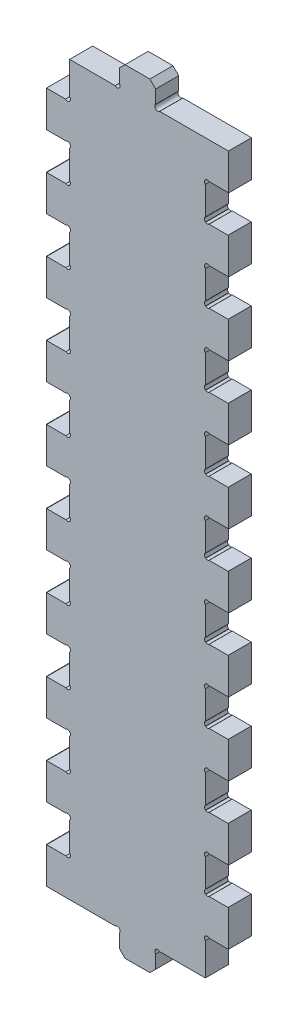
from build123d import *

# Parameters (mm, degrees)
BOSS_EXTRUDE1_DEPTH = 6.35
CHAMFER1_SIZE       = 1.5875
SKETCH1_W           = 6.288243006
SKETCH1_H           = 10.1524
SKETCH1_W_2         = 6.300894721
CUT_EXTRUDE1_DEPTH  = 213.416207009
LPATTERN1_COUNT     = 9
LPATTERN1_PITCH     = 20
SKETCH2_W           = 2.992753623
SKETCH2_H           = 0.405797101
CUT_EXTRUDE2_DEPTH  = 2.54


# Read off the part's stored shape, not the designer's step: Boss-Extrude1
with BuildPart() as part:
    # Boss-Extrude1 outline → Boss-Extrude1 (new body)
    with BuildSketch(Plane.XY):
        with BuildLine():
            Line((43.65, 81.122532015), (43.65, 88.877467985))
            ThreePointArc((43.65, 88.877467985), (43.65, 90), (44.772532015, 90))
            Line((44.772532015, 90), (50, 90))
            Line((50, 90), (50, 100))
            Line((50, 100), (44.772532015, 100))
            ThreePointArc((44.772532015, 100), (43.65, 100), (43.65, 101.122532015))
            Line((43.65, 101.122532015), (43.65, 108.877467985))
            ThreePointArc((43.65, 108.877467985), (43.65, 110), (44.772532015, 110))
            Line((44.772532015, 110), (50, 110))
            Line((50, 110), (50, 120))
            Line((50, 120), (44.772532015, 120))
            ThreePointArc((44.772532015, 120), (43.65, 120), (43.65, 121.122532015))
            Line((43.65, 121.122532015), (43.65, 128.877467985))
            ThreePointArc((43.65, 128.877467985), (43.65, 130), (44.772532015, 130))
            Line((44.772532015, 130), (50, 130))
            Line((50, 130), (50, 140))
            Line((50, 140), (44.772532015, 140))
            ThreePointArc((44.772532015, 140), (43.65, 140), (43.65, 141.122532015))
            Line((43.65, 141.122532015), (43.65, 148.877467985))
            ThreePointArc((43.65, 148.877467985), (43.65, 150), (44.772532015, 150))
            Line((44.772532015, 150), (50, 150))
            Line((50, 150), (50, 160))
            Line((50, 160), (44.772532015, 160))
            ThreePointArc((44.772532015, 160), (43.65, 160), (43.65, 161.122532015))
            Line((43.65, 161.122532015), (43.65, 168.877467985))
            ThreePointArc((43.65, 168.877467985), (43.65, 170), (44.772532015, 170))
            Line((44.772532015, 170), (50, 170))
            Line((50, 170), (50, 180))
            Line((50, 180), (44.772532015, 180))
            ThreePointArc((44.772532015, 180), (43.65, 180), (43.65, 181.122532015))
            Line((43.65, 181.122532015), (43.65, 188.877467985))
            ThreePointArc((43.65, 188.877467985), (43.65, 190), (44.772532015, 190))
            Line((44.772532015, 190), (50, 190))
            Line((50, 190), (50, 200))
            Line((50, 200), (31.122532015, 200))
            ThreePointArc((31.122532015, 200), (30, 200), (30, 201.122532015))
            Line((30, 201.122532015), (30, 206.35))
            Line((30, 206.35), (20, 206.35))
            Line((20, 206.35), (20, 201.122532015))
            ThreePointArc((20, 201.122532015), (20, 200), (18.877467985, 200))
            Line((18.877467985, 200), (6.35, 200))
            Line((6.35, 200), (6.35, 191.122532015))
            ThreePointArc((6.35, 191.122532015), (6.35, 190), (5.227467985, 190))
            Line((5.227467985, 190), (0, 190))
            Line((0, 190), (0, 180))
            Line((0, 180), (5.227467985, 180))
            ThreePointArc((5.227467985, 180), (6.35, 180), (6.35, 178.877467985))
            Line((6.35, 178.877467985), (6.35, 171.122532015))
            ThreePointArc((6.35, 171.122532015), (6.35, 170), (5.227467985, 170))
            Line((5.227467985, 170), (0, 170))
            Line((0, 170), (0, 160))
            Line((0, 160), (5.227467985, 160))
            ThreePointArc((5.227467985, 160), (6.35, 160), (6.35, 158.877467985))
            Line((6.35, 158.877467985), (6.35, 151.122532015))
            ThreePointArc((6.35, 151.122532015), (6.35, 150), (5.227467985, 150))
            Line((5.227467985, 150), (0, 150))
            Line((0, 150), (0, 140))
            Line((0, 140), (5.227467985, 140))
            ThreePointArc((5.227467985, 140), (6.35, 140), (6.35, 138.877467985))
            Line((6.35, 138.877467985), (6.35, 131.122532015))
            ThreePointArc((6.35, 131.122532015), (6.35, 130), (5.227467985, 130))
            Line((5.227467985, 130), (0, 130))
            Line((0, 130), (0, 120))
            Line((0, 120), (5.227467985, 120))
            ThreePointArc((5.227467985, 120), (6.35, 120), (6.35, 118.877467985))
            Line((6.35, 118.877467985), (6.35, 111.122532015))
            ThreePointArc((6.35, 111.122532015), (6.35, 110), (5.227467985, 110))
            Line((5.227467985, 110), (0, 110))
            Line((0, 110), (0, 100))
            Line((0, 100), (5.227467985, 100))
            ThreePointArc((5.227467985, 100), (6.35, 100), (6.35, 98.877467985))
            Line((6.35, 98.877467985), (6.35, 91.122532015))
            ThreePointArc((6.35, 91.122532015), (6.35, 90), (5.227467985, 90))
            Line((5.227467985, 90), (0, 90))
            Line((0, 90), (0, 80))
            Line((0, 80), (5.227467985, 80))
            ThreePointArc((5.227467985, 80), (6.35, 80), (6.35, 78.877467985))
            Line((6.35, 78.877467985), (6.35, 71.122532015))
            ThreePointArc((6.35, 71.122532015), (6.35, 70), (5.227467985, 70))
            Line((5.227467985, 70), (0, 70))
            Line((0, 70), (0, 60))
            Line((0, 60), (5.227467985, 60))
            ThreePointArc((5.227467985, 60), (6.35, 60), (6.35, 58.877467985))
            Line((6.35, 58.877467985), (6.35, 51.122532015))
            ThreePointArc((6.35, 51.122532015), (6.35, 50), (5.227467985, 50))
            Line((5.227467985, 50), (0, 50))
            Line((0, 50), (0, 40))
            Line((0, 40), (5.227467985, 40))
            ThreePointArc((5.227467985, 40), (6.35, 40), (6.35, 38.877467985))
            Line((6.35, 38.877467985), (6.35, 31.122532015))
            ThreePointArc((6.35, 31.122532015), (6.35, 30), (5.227467985, 30))
            Line((5.227467985, 30), (0, 30))
            Line((0, 30), (0, 20))
            Line((0, 20), (5.227467985, 20))
            ThreePointArc((5.227467985, 20), (6.35, 20), (6.35, 18.877467985))
            Line((6.35, 18.877467985), (6.35, 11.122532015))
            ThreePointArc((6.35, 11.122532015), (6.35, 10), (5.227467985, 10))
            Line((5.227467985, 10), (0, 10))
            Line((0, 10), (0, 0))
            Line((0, 0), (18.877467985, 0))
            ThreePointArc((18.877467985, 0), (20, 0), (20, -1.122532015))
            Line((20, -1.122532015), (20, -6.35))
            Line((20, -6.35), (30, -6.35))
            Line((30, -6.35), (30, -1.122532015))
            ThreePointArc((30, -1.122532015), (30, 0), (31.122532015, 0))
            Line((31.122532015, 0), (43.65, 0))
            Line((43.65, 0), (43.65, 8.877467985))
            ThreePointArc((43.65, 8.877467985), (43.65, 10), (44.772532015, 10))
            Line((44.772532015, 10), (50, 10))
            Line((50, 10), (50, 20))
            Line((50, 20), (44.772532015, 20))
            ThreePointArc((44.772532015, 20), (43.65, 20), (43.65, 21.122532015))
            Line((43.65, 21.122532015), (43.65, 28.877467985))
            ThreePointArc((43.65, 28.877467985), (43.65, 30), (44.772532015, 30))
            Line((44.772532015, 30), (50, 30))
            Line((50, 30), (50, 40))
            Line((50, 40), (44.772532015, 40))
            ThreePointArc((44.772532015, 40), (43.65, 40), (43.65, 41.122532015))
            Line((43.65, 41.122532015), (43.65, 48.877467985))
            ThreePointArc((43.65, 48.877467985), (43.65, 50), (44.772532015, 50))
            Line((44.772532015, 50), (50, 50))
            Line((50, 50), (50, 60))
            Line((50, 60), (44.772532015, 60))
            ThreePointArc((44.772532015, 60), (43.65, 60), (43.65, 61.122532015))
            Line((43.65, 61.122532015), (43.65, 68.877467985))
            ThreePointArc((43.65, 68.877467985), (43.65, 70), (44.772532015, 70))
            Line((44.772532015, 70), (50, 70))
            Line((50, 70), (50, 80))
            Line((50, 80), (44.772532015, 80))
            ThreePointArc((44.772532015, 80), (43.65, 80), (43.65, 81.122532015))
        make_face()
    extrude(amount=BOSS_EXTRUDE1_DEPTH)

    # Chamfer1
    chamfer1_edges = [part.edges().sort_by_distance(p)[0] for p in [
        (30, -6.35, 3.175),
        (20, -6.35, 3.175),
        (20, 206.35, 3.175),
        (30, 206.35, 3.175),
    ]]
    chamfer(chamfer1_edges, length=CHAMFER1_SIZE)

    # Sketch1 → Cut-Extrude1 (cut, through all)
    with BuildSketch(Plane.XY.offset(6.35)):
        with Locations((3.175005578, 175)):
            Rectangle(SKETCH1_W, SKETCH1_H)
        with Locations((46.824995526, 185)):
            Rectangle(SKETCH1_W_2, SKETCH1_H)
    cut_extrude1 = extrude(amount=-CUT_EXTRUDE1_DEPTH, mode=Mode.SUBTRACT)

    # LPattern1: Cut-Extrude1 ×9
    with Locations(*[(0, -i * LPATTERN1_PITCH, 0) for i in range(1, LPATTERN1_COUNT)]):
        add(cut_extrude1, mode=Mode.SUBTRACT)

    # Sketch2 → Cut-Extrude2 (cut)
    # profile 1 of 8: a face of its own
    with BuildSketch(Plane(origin=(0, 0, 0), x_dir=(-1, 0, 0), z_dir=(0, 0, -1))):
        with BuildLine():
            add(Edge.make_bspline(
                [(-11.980434783, 197.750941647), (-11.910808489, 197.774482029), (-11.771664099, 197.821526211), (-11.555640029, 197.867946068), (-11.335332216, 197.897801238), (-11.186640087, 197.9013359), (-11.111775362, 197.90311556)],
                knots=[0, 0, 0, 0, 0.994488486, 1.987431555, 2.986695647, 4, 4, 4, 4], degree=3))
            add(Edge.make_bspline(
                [(-11.111775362, 197.90311556), (-11.05254015, 197.901735769), (-10.937130794, 197.899047491), (-10.769325868, 197.878500612), (-10.612296865, 197.843425686), (-10.465271323, 197.795823751), (-10.330023421, 197.731389451), (-10.204221941, 197.655235673), (-10.089369065, 197.564290581), (-9.985915155, 197.458859286), (-9.893783764, 197.34017602), (-9.812916705, 197.20835234), (-9.745945374, 197.062602349), (-9.691314855, 196.903725539), (-9.648801528, 196.731815794), (-9.618170665, 196.546875928), (-9.599922356, 196.348454994), (-9.597584367, 196.211805499), (-9.596376812, 196.141226973)],
                knots=[0, 0, 0, 0, 1.072611527, 2.089794271, 3.055581239, 3.983062688, 4.882004399, 5.762484854, 6.641234626, 7.527661933, 8.431137849, 9.356753919, 10.322173417, 11.329916297, 12.395192928, 13.52550975, 14.721942779, 16, 16, 16, 16], degree=3))
            add(Edge.make_bspline(
                [(-9.596376812, 196.141226973), (-9.597826972, 196.072491969), (-9.600660995, 195.938164378), (-9.620448173, 195.741481707), (-9.654333732, 195.55486754), (-9.701885812, 195.378938505), (-9.761015566, 195.214319069), (-9.832414573, 195.06209312), (-9.915722389, 194.922884328), (-10.010344121, 194.796720603), (-10.116629395, 194.684246688), (-10.233247243, 194.584630449), (-10.361197037, 194.499499449), (-10.49863623, 194.427797069), (-10.645940087, 194.37132884), (-10.802277721, 194.331182069), (-10.967222779, 194.305740648), (-11.080241691, 194.303043167), (-11.137930254, 194.301666285)],
                knots=[0, 0, 0, 0, 1.219605637, 2.383453508, 3.503420428, 4.581493474, 5.613637893, 6.603468646, 7.560207789, 8.487492747, 9.396163682, 10.300762231, 11.203110698, 12.117315488, 13.046269834, 13.995710842, 14.976945019, 16, 16, 16, 16], degree=3))
            add(Edge.make_bspline(
                [(-11.137930254, 194.301666285), (-11.17730863, 194.302082953), (-11.254810493, 194.30290301), (-11.368724701, 194.310544894), (-11.478618874, 194.320962333), (-11.618020807, 194.343473627), (-11.787188939, 194.382017712), (-11.916157014, 194.429950478), (-11.980434783, 194.453840198)],
                knots=[0, 0, 0, 0, 0.822626155, 1.619037258, 2.384688107, 3.12792479, 4.568555946, 6, 6, 6, 6], degree=3))
            Line((-11.980434783, 194.453840198), (-11.980434783, 194.910361937))
            add(Edge.make_bspline(
                [(-11.980434783, 194.910361937), (-11.94918244, 194.894384261), (-11.887250767, 194.862721859), (-11.791296825, 194.822227498), (-11.693860043, 194.787552165), (-11.594405533, 194.757408159), (-11.491160414, 194.735714483), (-11.384109045, 194.718617622), (-11.272305975, 194.709298747), (-11.196331968, 194.708081586), (-11.157744565, 194.707463386)],
                knots=[0, 0, 0, 0, 0.983513914, 1.948995141, 2.916291929, 3.881574371, 4.859020865, 5.870675395, 6.918510301, 8, 8, 8, 8], degree=3))
            add(Edge.make_bspline(
                [(-11.157744565, 194.707463386), (-11.118298946, 194.708338051), (-11.040812889, 194.710056222), (-10.927951046, 194.729225669), (-10.820608309, 194.758204113), (-10.719660859, 194.799841942), (-10.624784183, 194.85189007), (-10.538252255, 194.916223742), (-10.45790836, 194.989524697), (-10.385933705, 195.074323927), (-10.320400401, 195.168726608), (-10.26472386, 195.274354392), (-10.215098966, 195.388559737), (-10.175089938, 195.513194807), (-10.142496376, 195.646874086), (-10.119876023, 195.790009932), (-10.106357968, 195.942029028), (-10.104552061, 196.046353634), (-10.103623188, 196.100013205)],
                knots=[0, 0, 0, 0, 0.961379654, 1.888511819, 2.784473984, 3.668957356, 4.545988938, 5.417413694, 6.293189242, 7.19359124, 8.125014672, 9.091028027, 10.101492058, 11.15929442, 12.280112618, 13.455191333, 14.691072557, 16, 16, 16, 16], degree=3))
            add(Edge.make_bspline(
                [(-10.103623188, 196.100013205), (-10.104279682, 196.156045066), (-10.105551143, 196.264564559), (-10.118282272, 196.422100739), (-10.139770132, 196.568946395), (-10.168075198, 196.705811394), (-10.207570319, 196.831074698), (-10.252845969, 196.946674705), (-10.308874295, 197.050705115), (-10.372033391, 197.144976812), (-10.444154984, 197.227969509), (-10.523426101, 197.301231742), (-10.612549541, 197.36110343), (-10.70801986, 197.412059214), (-10.812318312, 197.449646578), (-10.923789687, 197.477497305), (-11.04336801, 197.494349547), (-11.125722455, 197.496310592), (-11.168048007, 197.497318458)],
                knots=[0, 0, 0, 0, 1.344986745, 2.604897925, 3.790693513, 4.906561358, 5.955763371, 6.940386222, 7.882436293, 8.786639374, 9.6589598, 10.516513575, 11.369740757, 12.229356076, 13.108292045, 14.02357188, 14.984227133, 16, 16, 16, 16], degree=3))
            add(Edge.make_bspline(
                [(-11.168048007, 197.497318458), (-11.204535527, 197.496804387), (-11.276867419, 197.495785306), (-11.384272153, 197.484719098), (-11.489556057, 197.468787813), (-11.625664857, 197.436136281), (-11.792332677, 197.384731417), (-11.917679042, 197.324550169), (-11.980434783, 197.294419908)],
                knots=[0, 0, 0, 0, 0.776740194, 1.539789185, 2.297342553, 3.042488778, 4.519296457, 6, 6, 6, 6], degree=3))
            Line((-11.980434783, 197.294419908), (-11.980434783, 197.750941647))
        make_face()
    # profile 2 of 8: a face of its own
    with BuildSketch(Plane(origin=(0, 0, 0), x_dir=(-1, 0, 0), z_dir=(0, 0, -1))):
        with BuildLine():
            add(Edge.make_bspline(
                [(-15.176086957, 196.079406321), (-15.174771545, 196.155545347), (-15.172231466, 196.302570874), (-15.151308744, 196.515001048), (-15.118130195, 196.711634176), (-15.069724598, 196.892163431), (-15.008957382, 197.056546508), (-14.940397786, 197.206966734), (-14.86119578, 197.341840598), (-14.77277724, 197.46226813), (-14.674486067, 197.567059165), (-14.569409518, 197.659291985), (-14.45447056, 197.734843734), (-14.333083054, 197.797066416), (-14.205354243, 197.844037281), (-14.074059365, 197.878613559), (-13.939232158, 197.898644395), (-13.848327544, 197.901618272), (-13.802558877, 197.90311556)],
                knots=[0, 0, 0, 0, 1.423032467, 2.74789565, 3.986095212, 5.146946287, 6.235977115, 7.259045831, 8.233104616, 9.154680255, 10.045738054, 10.914074377, 11.761945621, 12.610090105, 13.458637099, 14.300735339, 15.144454002, 16, 16, 16, 16], degree=3))
            add(Edge.make_bspline(
                [(-13.802558877, 197.90311556), (-13.748596863, 197.901519891), (-13.643894221, 197.898423811), (-13.491777719, 197.876600142), (-13.350997388, 197.837353492), (-13.220196311, 197.784325199), (-13.101101854, 197.715530574), (-12.991808098, 197.634048671), (-12.893892487, 197.538257879), (-12.807251809, 197.428663355), (-12.730945273, 197.306184641), (-12.664179781, 197.171565813), (-12.610091483, 197.023445331), (-12.564800826, 196.864008607), (-12.530756348, 196.692952246), (-12.505191733, 196.511203539), (-12.490128224, 196.319020109), (-12.488509105, 196.187222831), (-12.487681159, 196.119827516)],
                knots=[0, 0, 0, 0, 1.030205197, 1.998909912, 2.925271583, 3.814184362, 4.686309791, 5.543784517, 6.410540358, 7.293595139, 8.204656581, 9.161097379, 10.157022635, 11.210838011, 12.322710013, 13.48400651, 14.713431915, 16, 16, 16, 16], degree=3))
            add(Edge.make_bspline(
                [(-12.487681159, 196.119827516), (-12.489103582, 196.04449099), (-12.491853818, 195.898828739), (-12.511416567, 195.687872829), (-12.545069085, 195.492456089), (-12.592624482, 195.31245948), (-12.652212847, 195.148036018), (-12.721224493, 194.99810088), (-12.799394098, 194.862339633), (-12.888522038, 194.742126758), (-12.986580423, 194.636821352), (-13.092191658, 194.545841852), (-13.206175828, 194.469611896), (-13.327169003, 194.408148274), (-13.453828345, 194.360553231), (-13.584416592, 194.326109451), (-13.718987351, 194.306142846), (-13.809892364, 194.30316538), (-13.855661232, 194.301666285)],
                knots=[0, 0, 0, 0, 1.413051082, 2.732116977, 3.969679154, 5.128442986, 6.219508914, 7.246084667, 8.220979251, 9.152645917, 10.046758226, 10.914837981, 11.761492386, 12.612544275, 13.454719919, 14.29491033, 15.141521225, 16, 16, 16, 16], degree=3))
            add(Edge.make_bspline(
                [(-13.855661232, 194.301666285), (-13.90964448, 194.303151965), (-14.014688824, 194.306042904), (-14.166738924, 194.329462218), (-14.308341052, 194.366946721), (-14.438473901, 194.421302537), (-14.557584663, 194.490388126), (-14.667019041, 194.572013953), (-14.764785966, 194.668542572), (-14.853677415, 194.77663151), (-14.930292573, 194.8990667), (-14.997060368, 195.033347521), (-15.052193753, 195.180470021), (-15.098037373, 195.339171784), (-15.133572751, 195.509270472), (-15.157106098, 195.690278859), (-15.174055158, 195.88120747), (-15.175398635, 196.012261581), (-15.176086957, 196.079406321)],
                knots=[0, 0, 0, 0, 1.031565915, 2.007292433, 2.933542939, 3.825562189, 4.694461596, 5.560140367, 6.428041038, 7.314667795, 8.229626955, 9.182805641, 10.177100349, 11.228845024, 12.338260739, 13.495395501, 14.716781815, 16, 16, 16, 16], degree=3))
        make_face()
        with BuildLine():
            add(Edge.make_bspline(
                [(-14.66884058, 196.113486937), (-14.668104325, 196.062754666), (-14.666661604, 195.963342785), (-14.659112786, 195.817323142), (-14.644731767, 195.677971105), (-14.625210171, 195.545636766), (-14.599851804, 195.420845169), (-14.56528676, 195.305413914), (-14.52602863, 195.19787145), (-14.478831316, 195.099685024), (-14.423864296, 195.011407792), (-14.363049349, 194.93238167), (-14.292856708, 194.865666962), (-14.21702944, 194.807391129), (-14.131375198, 194.762764903), (-14.038085919, 194.730009945), (-13.93622166, 194.710867881), (-13.865781731, 194.708620665), (-13.829506341, 194.707463386)],
                knots=[0, 0, 0, 0, 1.323224684, 2.592910887, 3.811929415, 4.975431619, 6.080847083, 7.12955438, 8.115035924, 9.06419821, 9.964747517, 10.823495656, 11.656766287, 12.483602299, 13.309634052, 14.163864548, 15.054420842, 16, 16, 16, 16], degree=3))
            add(Edge.make_bspline(
                [(-13.829506341, 194.707463386), (-13.794265277, 194.708823771), (-13.725529993, 194.71147711), (-13.626565143, 194.732373671), (-13.53532031, 194.766790374), (-13.452296433, 194.815090147), (-13.376747759, 194.87511133), (-13.308366436, 194.945404655), (-13.247032964, 195.025257061), (-13.193108891, 195.114827257), (-13.145970427, 195.213223055), (-13.104573434, 195.319644786), (-13.070755463, 195.434291436), (-13.043596163, 195.556211276), (-13.021063583, 195.683877317), (-13.006806767, 195.816293169), (-12.996583139, 195.952435228), (-12.995485311, 196.044512933), (-12.994927536, 196.091294908)],
                knots=[0, 0, 0, 0, 0.938375319, 1.830236864, 2.681329516, 3.526521267, 4.378544967, 5.244700333, 6.133138318, 7.055481868, 8.025176963, 9.036984759, 10.094880601, 11.206586202, 12.363869853, 13.547026066, 14.753716057, 16, 16, 16, 16], degree=3))
            add(Edge.make_bspline(
                [(-12.994927536, 196.091294908), (-12.995554209, 196.142561735), (-12.996776188, 196.242529233), (-13.005769451, 196.389008359), (-13.0195816, 196.528457315), (-13.040026297, 196.660800429), (-13.066826466, 196.78523405), (-13.099518015, 196.901313999), (-13.140383308, 197.00791249), (-13.18637062, 197.105941137), (-13.240975353, 197.19342316), (-13.300690973, 197.272606444), (-13.370597388, 197.338964761), (-13.44636823, 197.396383534), (-13.53032357, 197.442040613), (-13.62274568, 197.474851461), (-13.723576272, 197.493907207), (-13.79349408, 197.496158761), (-13.829506341, 197.497318458)],
                knots=[0, 0, 0, 0, 1.340763136, 2.614414457, 3.836861922, 5.004679881, 6.114646625, 7.164372586, 8.155062869, 9.097671087, 9.991240131, 10.848152089, 11.683766599, 12.503256002, 13.328782241, 14.17238617, 15.058658899, 16, 16, 16, 16], degree=3))
            add(Edge.make_bspline(
                [(-13.829506341, 197.497318458), (-13.864726556, 197.495873249), (-13.933109002, 197.493067276), (-14.032397832, 197.473411738), (-14.123491589, 197.437761024), (-14.207460738, 197.389744045), (-14.283866648, 197.329971708), (-14.352132282, 197.25887327), (-14.415229102, 197.179859368), (-14.469930885, 197.090134376), (-14.516822102, 196.99174734), (-14.558446295, 196.885610107), (-14.592939279, 196.771301666), (-14.621334631, 196.64980419), (-14.642437177, 196.522133205), (-14.657087598, 196.389827514), (-14.667156303, 196.253133776), (-14.668273177, 196.160531474), (-14.66884058, 196.113486937)],
                knots=[0, 0, 0, 0, 0.936751022, 1.818765843, 2.677461868, 3.527284708, 4.383360161, 5.248016241, 6.143560069, 7.067973536, 8.03599012, 9.039498541, 10.097595286, 11.208955057, 12.356128457, 13.537236666, 14.748847947, 16, 16, 16, 16], degree=3))
        make_face(mode=Mode.SUBTRACT)
    # profile 3 of 8: a face of its own
    with BuildSketch(Plane(origin=(0, 0, 0), x_dir=(-1, 0, 0), z_dir=(0, 0, -1))):
        Polygon((-17.965942029, 197.852390922), (-15.936956522, 197.852390922), (-15.936956522, 194.352390922), (-16.444202899, 194.352390922), (-16.444202899, 197.446593821), (-17.965942029, 197.446593821), align=None)
    # profile 4 of 8: a face of its own
    with BuildSketch(Plane(origin=(0, 0, 0), x_dir=(-1, 0, 0), z_dir=(0, 0, -1))):
        with Locations((-19.817391304, 198.7654344)):
            Rectangle(SKETCH2_W, SKETCH2_H)
    # profile 5 of 8: a face of its own
    with BuildSketch(Plane(origin=(0, 0, 0), x_dir=(-1, 0, 0), z_dir=(0, 0, -1))):
        Polygon((-24.28115942, 197.852390922), (-23.762024457, 197.852390922), (-23.527423007, 197.091521357), (-22.073845109, 197.091521357), (-21.833695652, 197.852390922), (-21.339130435, 197.852390922), (-22.502626812, 194.352390922), (-23.154913949, 194.352390922), align=None)
        Polygon((-23.40298913, 196.685724256), (-22.810144928, 194.760565741), (-22.202241848, 196.685724256), align=None, mode=Mode.SUBTRACT)
    # profile 6 of 8: a face of its own
    with BuildSketch(Plane(origin=(0, 0, 0), x_dir=(-1, 0, 0), z_dir=(0, 0, -1))):
        with BuildLine():
            add(Edge.make_bspline(
                [(-27.045652174, 194.910361937), (-26.978034088, 194.880456409), (-26.84365519, 194.821024502), (-26.667364782, 194.766984585), (-26.522396906, 194.736144179), (-26.408553319, 194.719722496), (-26.290008451, 194.709011006), (-26.2092479, 194.707984287), (-26.168274457, 194.707463386)],
                knots=[0, 0, 0, 0, 1.464330601, 2.910096185, 3.643252908, 4.399959025, 5.188227586, 6, 6, 6, 6], degree=3))
            add(Edge.make_bspline(
                [(-26.168274457, 194.707463386), (-26.121703205, 194.708595353), (-26.030795866, 194.710804958), (-25.898872775, 194.730476247), (-25.774444908, 194.760875175), (-25.658741238, 194.80561285), (-25.551077604, 194.86153896), (-25.451496117, 194.927154022), (-25.36129371, 195.004054692), (-25.279933789, 195.090998927), (-25.207790303, 195.188278319), (-25.144248049, 195.294713298), (-25.09027527, 195.410636774), (-25.04532914, 195.535044979), (-25.00954378, 195.667568448), (-24.984881754, 195.80736806), (-24.968054138, 195.9537705), (-24.966655936, 196.053730238), (-24.965942029, 196.10476864)],
                knots=[0, 0, 0, 0, 1.073769489, 2.096003926, 3.070122125, 4.023153935, 4.949964709, 5.864449599, 6.768127035, 7.677949219, 8.605561213, 9.556720354, 10.532800371, 11.550774494, 12.60488817, 13.695135903, 14.823160392, 16, 16, 16, 16], degree=3))
            add(Edge.make_bspline(
                [(-24.965942029, 196.10476864), (-24.966680717, 196.157892013), (-24.968119622, 196.261372181), (-24.979912168, 196.412293139), (-25.00044294, 196.554454229), (-25.028941571, 196.687931781), (-25.064599456, 196.812728949), (-25.110814289, 196.927734569), (-25.166266491, 197.03272596), (-25.230912304, 197.12808513), (-25.304654637, 197.213204276), (-25.388097014, 197.288037982), (-25.481595449, 197.351524989), (-25.584668302, 197.405032204), (-25.697899827, 197.447445642), (-25.821861406, 197.47581389), (-25.955799149, 197.494934186), (-26.048787413, 197.496504991), (-26.096942935, 197.497318458)],
                knots=[0, 0, 0, 0, 1.243255238, 2.42176375, 3.540213943, 4.602614008, 5.614224991, 6.57415249, 7.498033241, 8.388147477, 9.2647573, 10.127451972, 11.003865497, 11.902699846, 12.839913848, 13.825275076, 14.873782462, 16, 16, 16, 16], degree=3))
            add(Edge.make_bspline(
                [(-26.096942935, 197.497318458), (-26.114650213, 197.496937521), (-26.151423544, 197.496146416), (-26.207992487, 197.491985282), (-26.266716297, 197.485895043), (-26.325577188, 197.476902527), (-26.383732239, 197.467279426), (-26.43894462, 197.453232585), (-26.49090593, 197.440026757), (-26.523157336, 197.428341456), (-26.538405797, 197.422816647)],
                knots=[0, 0, 0, 0, 0.945166588, 1.962860859, 3.026411364, 4.095276625, 5.140821118, 6.170267557, 7.134902696, 8, 8, 8, 8], degree=3))
            Line((-26.538405797, 197.422816647), (-26.538405797, 196.279927154))
            Line((-26.538405797, 196.279927154), (-25.834601449, 196.279927154))
            Line((-25.834601449, 196.279927154), (-25.834601449, 195.874130053))
            Line((-25.834601449, 195.874130053), (-27.045652174, 195.874130053))
            Line((-27.045652174, 195.874130053), (-27.045652174, 197.688328422))
            add(Edge.make_bspline(
                [(-27.045652174, 197.688328422), (-27.007572794, 197.705285704), (-26.930315177, 197.739689603), (-26.808670178, 197.781120311), (-26.683829779, 197.820044496), (-26.555037705, 197.849043187), (-26.426240795, 197.874381655), (-26.297496469, 197.890315233), (-26.171639909, 197.901392641), (-26.088511894, 197.902549189), (-26.047803442, 197.90311556)],
                knots=[0, 0, 0, 0, 0.972496529, 1.973056419, 2.997281468, 4.02341692, 5.052679233, 6.060057326, 7.049994611, 8, 8, 8, 8], degree=3))
            add(Edge.make_bspline(
                [(-26.047803442, 197.90311556), (-25.988041647, 197.90172049), (-25.871320271, 197.898995764), (-25.700579621, 197.878450157), (-25.539358036, 197.842589663), (-25.386943879, 197.793720406), (-25.245107252, 197.730316793), (-25.113461313, 197.653718117), (-24.993306928, 197.562874397), (-24.884042607, 197.458312643), (-24.786116149, 197.34031565), (-24.699848634, 197.208639854), (-24.62726594, 197.062524474), (-24.566268324, 196.903571392), (-24.517877906, 196.731422891), (-24.483369451, 196.546318722), (-24.462682172, 196.348030196), (-24.460051316, 196.211552866), (-24.458695652, 196.141226973)],
                knots=[0, 0, 0, 0, 1.063687381, 2.077498743, 3.055353115, 3.999737203, 4.921796415, 5.815487126, 6.705271528, 7.596707349, 8.501722647, 9.429139237, 10.392398034, 11.400269077, 12.455816192, 13.570948003, 14.748325073, 16, 16, 16, 16], degree=3))
            add(Edge.make_bspline(
                [(-24.458695652, 196.141226973), (-24.460210956, 196.071151954), (-24.463170031, 195.934309975), (-24.486423808, 195.734599121), (-24.524818915, 195.545838291), (-24.579716108, 195.369049239), (-24.647815888, 195.204198283), (-24.729047335, 195.052263384), (-24.821647341, 194.912226152), (-24.92860734, 194.786697215), (-25.046995074, 194.67439247), (-25.177008562, 194.576287987), (-25.318572443, 194.492629669), (-25.470747318, 194.422965821), (-25.632540921, 194.368413082), (-25.802957398, 194.329402871), (-25.981381317, 194.306287402), (-26.103215619, 194.303222946), (-26.165104167, 194.301666285)],
                knots=[0, 0, 0, 0, 1.187521249, 2.318982697, 3.402720272, 4.448029833, 5.451796904, 6.421421178, 7.364085339, 8.291804177, 9.210421657, 10.12483832, 11.046419793, 11.992205824, 12.956562841, 13.935295634, 14.951185731, 16, 16, 16, 16], degree=3))
            add(Edge.make_bspline(
                [(-26.165104167, 194.301666285), (-26.243915772, 194.303514185), (-26.398311501, 194.307134311), (-26.588376255, 194.330477717), (-26.734730905, 194.357171769), (-26.840297621, 194.385352699), (-26.944636173, 194.415027286), (-27.012006983, 194.440912861), (-27.045652174, 194.453840198)],
                knots=[0, 0, 0, 0, 1.577955442, 3.091290686, 3.829077035, 4.555391532, 5.278558076, 6, 6, 6, 6], degree=3))
            Line((-27.045652174, 194.453840198), (-27.045652174, 194.910361937))
        make_face()
    # profile 7 of 8: a face of its own
    with BuildSketch(Plane(origin=(0, 0, 0), x_dir=(-1, 0, 0), z_dir=(0, 0, -1))):
        Polygon((-30.266666667, 197.852390922), (-29.747531703, 197.852390922), (-29.512930254, 197.091521357), (-28.059352355, 197.091521357), (-27.819202899, 197.852390922), (-27.324637681, 197.852390922), (-28.488134058, 194.352390922), (-29.140421196, 194.352390922), align=None)
        Polygon((-29.388496377, 196.685724256), (-28.795652174, 194.760565741), (-28.187749094, 196.685724256), align=None, mode=Mode.SUBTRACT)
    # profile 8 of 8: a face of its own
    with BuildSketch(Plane(origin=(0, 0, 0), x_dir=(-1, 0, 0), z_dir=(0, 0, -1))):
        with BuildLine():
            Line((-33.081884058, 197.852390922), (-32.544519928, 197.852390922))
            Line((-32.544519928, 197.852390922), (-32.041236413, 196.759433495))
            add(Edge.make_bspline(
                [(-32.041236413, 196.759433495), (-32.022853333, 196.721075965), (-31.988626795, 196.649659997), (-31.931209638, 196.553913791), (-31.868255982, 196.479022266), (-31.802479358, 196.419216342), (-31.729134013, 196.377992105), (-31.650471983, 196.348027847), (-31.563012018, 196.334082731), (-31.502321599, 196.33182989), (-31.470584239, 196.330651792)],
                knots=[0, 0, 0, 0, 1.331205738, 2.478505458, 3.482134631, 4.384426606, 5.243875328, 6.099377306, 7.006091104, 8, 8, 8, 8], degree=3))
            Line((-31.470584239, 196.330651792), (-31.255797101, 196.330651792))
            Line((-31.255797101, 196.330651792), (-31.255797101, 197.852390922))
            Line((-31.255797101, 197.852390922), (-30.748550725, 197.852390922))
            Line((-30.748550725, 197.852390922), (-30.748550725, 194.352390922))
            Line((-30.748550725, 194.352390922), (-31.679030797, 194.352390922))
            add(Edge.make_bspline(
                [(-31.679030797, 194.352390922), (-31.72795174, 194.352895461), (-31.822297821, 194.353868485), (-31.958233763, 194.368474328), (-32.083976534, 194.387585234), (-32.198525941, 194.418387677), (-32.303175394, 194.455368788), (-32.397827887, 194.499933854), (-32.483508436, 194.550572052), (-32.559109841, 194.608546941), (-32.625157124, 194.673320175), (-32.680461592, 194.745313349), (-32.728040575, 194.822564508), (-32.764995357, 194.906489098), (-32.793715169, 194.995493588), (-32.812745686, 195.089404527), (-32.826411139, 195.187364921), (-32.827636129, 195.254288336), (-32.82826087, 195.288419002)],
                knots=[0, 0, 0, 0, 1.389921561, 2.680521759, 3.883115709, 5.001628036, 6.046889199, 7.034635465, 7.971022447, 8.870823454, 9.736470365, 10.592781675, 11.445462433, 12.309446173, 13.192989902, 14.098882218, 15.030437761, 16, 16, 16, 16], degree=3))
            add(Edge.make_bspline(
                [(-32.82826087, 195.288419002), (-32.827627731, 195.315920878), (-32.826382586, 195.370006717), (-32.817223288, 195.449972767), (-32.803373664, 195.527749167), (-32.782551515, 195.602936668), (-32.756419792, 195.675715521), (-32.724073941, 195.744815316), (-32.686304266, 195.810919612), (-32.642865762, 195.873297062), (-32.59351518, 195.932163055), (-32.538857696, 195.986767318), (-32.478763418, 196.037282235), (-32.412994771, 196.083187631), (-32.341486665, 196.124162205), (-32.265494413, 196.160947218), (-32.18419569, 196.191138976), (-32.127760072, 196.206394672), (-32.099094203, 196.21414364)],
                knots=[0, 0, 0, 0, 1.03276531, 2.031060615, 3.019791728, 3.997153996, 4.95769766, 5.921056297, 6.858933508, 7.814131639, 8.772109059, 9.740412343, 10.712369615, 11.717153809, 12.748583441, 13.804915837, 14.885030443, 16, 16, 16, 16], degree=3))
            add(Edge.make_bspline(
                [(-32.099094203, 196.21414364), (-32.12239832, 196.222696459), (-32.168635245, 196.239665824), (-32.232278501, 196.277380249), (-32.291999885, 196.321614465), (-32.345180044, 196.37691418), (-32.395598845, 196.441046769), (-32.445716339, 196.514002071), (-32.497892433, 196.59573512), (-32.530091777, 196.654863343), (-32.546897645, 196.685724256)],
                knots=[0, 0, 0, 0, 0.89077261, 1.767352394, 2.648859128, 3.55564409, 4.515456796, 5.580012629, 6.736931117, 8, 8, 8, 8], degree=3))
            Line((-32.546897645, 196.685724256), (-33.081884058, 197.852390922))
        make_face()
        with BuildLine():
            add(Edge.make_bspline(
                [(-32.321014493, 195.322499618), (-32.320642949, 195.299492441), (-32.319923067, 195.254914986), (-32.311971261, 195.190382886), (-32.298331872, 195.130485491), (-32.28026811, 195.074921148), (-32.25739465, 195.023573917), (-32.2284021, 194.977078644), (-32.194297533, 194.935039288), (-32.155179464, 194.897463884), (-32.111028245, 194.864819295), (-32.062533422, 194.836463861), (-32.009941028, 194.811520343), (-31.952734565, 194.791901663), (-31.891370539, 194.777114449), (-31.826013317, 194.765772531), (-31.756288976, 194.759711372), (-31.708366395, 194.758704475), (-31.683786232, 194.758188024)],
                knots=[0, 0, 0, 0, 1.135705444, 2.200481127, 3.203777096, 4.165053602, 5.081738276, 5.972335559, 6.862741706, 7.74854822, 8.64353036, 9.567612247, 10.518921536, 11.513271118, 12.547969405, 13.633248542, 14.786060067, 16, 16, 16, 16], degree=3))
            Line((-31.683786232, 194.758188024), (-31.255797101, 194.758188024))
            Line((-31.255797101, 194.758188024), (-31.255797101, 195.92485469))
            Line((-31.255797101, 195.92485469), (-31.622758152, 195.92485469))
            add(Edge.make_bspline(
                [(-31.622758152, 195.92485469), (-31.648926509, 195.924396512), (-31.70004376, 195.923501507), (-31.774566879, 195.916595207), (-31.845002926, 195.903681256), (-31.911142791, 195.886235467), (-31.973696444, 195.865423881), (-32.030708334, 195.837668532), (-32.084484644, 195.807565188), (-32.131851837, 195.770342849), (-32.175298803, 195.730108718), (-32.212738372, 195.684269109), (-32.245109722, 195.634153844), (-32.273205204, 195.5802966), (-32.294809418, 195.521724561), (-32.309357761, 195.458847912), (-32.319378499, 195.392034701), (-32.320460377, 195.346051345), (-32.321014493, 195.322499618)],
                knots=[0, 0, 0, 0, 1.202488327, 2.34893999, 3.434843806, 4.489065717, 5.491176095, 6.457874483, 7.399078131, 8.316972014, 9.218746321, 10.115685781, 11.028265031, 11.956776294, 12.901731017, 13.888201569, 14.918380382, 16, 16, 16, 16], degree=3))
        make_face(mode=Mode.SUBTRACT)
    extrude(amount=-CUT_EXTRUDE2_DEPTH, mode=Mode.SUBTRACT)


solid = part.part
